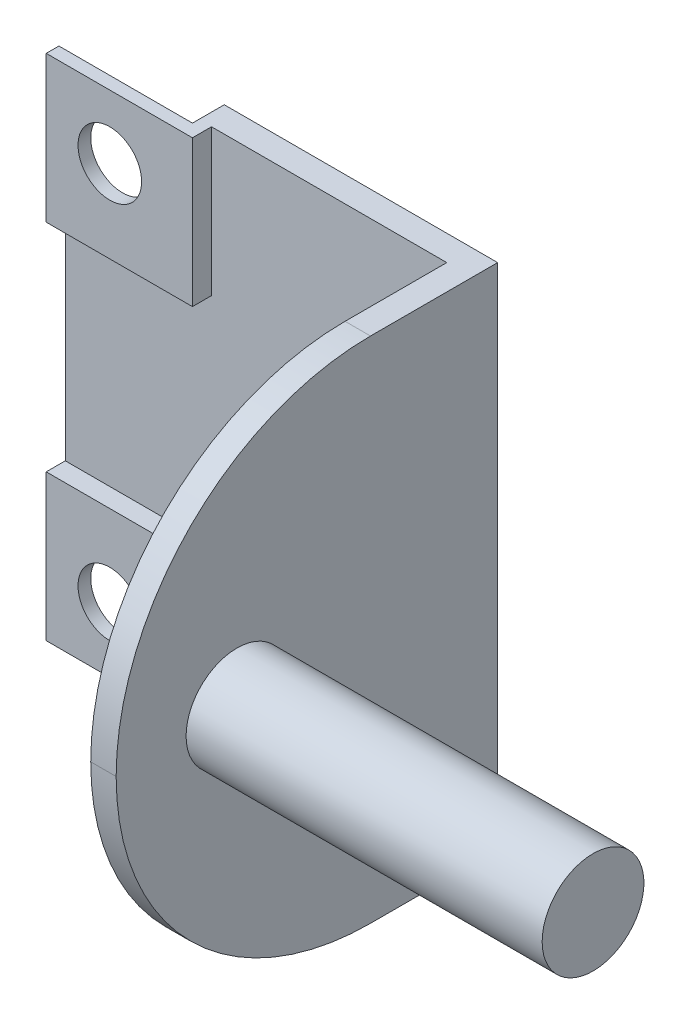
from build123d import *

# Parameters (mm, degrees)
ESQUISSE1_W             = 32
ESQUISSE1_H             = 40
BOSS_EXTRU_1_DEPTH      = 2
ESQUISSE2_W             = 2
ESQUISSE2_H             = 40
BOSS_EXTRU_2_DEPTH      = 28
CONG_1_R                = 20
ESQUISSE3_R             = 4
ENL_V_MAT_EXTRU_1_DEPTH = 30
ESQUISSE4_W             = 10.5
ESQUISSE4_H             = 10.5
ENL_V_MAT_EXTRU_2_DEPTH = 30
ESQUISSE5_W             = 1
ESQUISSE5_H             = 1
ESQUISSE5_W_2           = 10.5
ESQUISSE5_H_2           = 10.5
BOSS_EXTRU_5_DEPTH      = 1.5
ESQUISSE6_W             = 1
ESQUISSE6_H             = 10.5
BOSS_EXTRU_6_DEPTH      = 10.5
ESQUISSE7_R             = 2.5
ENL_V_MAT_EXTRU_3_DEPTH = 10.5
BOSS_EXTRU_7_START      = -30
ESQUISSE8_R             = 4
BOSS_EXTRU_7_DEPTH      = 30


with BuildPart() as part:
    # Esquisse1 → Boss.-Extru.1 (new body)
    with BuildSketch(Plane.XY):
        with Locations((-16, 20)):
            Rectangle(ESQUISSE1_W, ESQUISSE1_H)
    extrude(amount=BOSS_EXTRU_1_DEPTH)

    # Esquisse2 → Boss.-Extru.2 (add)
    with BuildSketch(Plane.XY.offset(2)):
        with Locations((-1, 20)):
            Rectangle(ESQUISSE2_W, ESQUISSE2_H)
    extrude(amount=BOSS_EXTRU_2_DEPTH)

    # Congé1
    cong_1_edges = [part.edges().sort_by_distance(p)[0] for p in [
        (-1, 40, 30),
        (-1, 0, 30),
    ]]
    fillet(cong_1_edges, radius=CONG_1_R - 0.0001)  # a hair under: the kernel refuses the full size

    # Esquisse3 → Enlèv. mat.-Extru.1 (cut)
    with BuildSketch(Plane(origin=(0, 0, 0), x_dir=(0, 0, -1), z_dir=(1, 0, 0))):
        with Locations(Location((-20.5, 20, 0), (0, 0, 90))):
            Circle(ESQUISSE3_R)
    extrude(amount=-ENL_V_MAT_EXTRU_1_DEPTH, mode=Mode.SUBTRACT)

    # Esquisse4 → Enlèv. mat.-Extru.2 (cut)
    with BuildSketch(Plane.XY.offset(2)):
        with Locations((-26.75, 34.75)):
            Rectangle(ESQUISSE4_W, ESQUISSE4_H)
        with Locations((-26.75, 5.25)):
            Rectangle(ESQUISSE4_W, ESQUISSE4_H)
    extrude(amount=-ENL_V_MAT_EXTRU_2_DEPTH, mode=Mode.SUBTRACT)

    # Esquisse5 → Boss.-Extru.5 (add)
    with BuildSketch(Plane.XY.offset(2)):
        with Locations((-21, 29)):
            Rectangle(ESQUISSE5_W, ESQUISSE5_H)
        with Locations((-26.75, 29)):
            Rectangle(ESQUISSE5_W_2, ESQUISSE5_H)
        with Locations((-21, 34.75)):
            Rectangle(ESQUISSE5_W, ESQUISSE5_H_2)
        with Locations((-21, 11)):
            Rectangle(ESQUISSE5_W, ESQUISSE5_H)
        with Locations((-21, 5.25)):
            Rectangle(ESQUISSE5_W, ESQUISSE5_H_2)
        with Locations((-26.75, 11)):
            Rectangle(ESQUISSE5_W_2, ESQUISSE5_H)
    extrude(amount=BOSS_EXTRU_5_DEPTH)

    # Esquisse6 → Boss.-Extru.6 (add)
    with BuildSketch(Plane.ZY.offset(21.5)):
        with Locations((3, 34.75)):
            Rectangle(ESQUISSE6_W, ESQUISSE6_H)
        with Locations((3, 5.25)):
            Rectangle(ESQUISSE6_W, ESQUISSE6_H)
    extrude(amount=BOSS_EXTRU_6_DEPTH)

    # Esquisse7 → Enlèv. mat.-Extru.3 (cut)
    with BuildSketch(Plane.XY.offset(3.5)):
        with Locations((-27, 35)):
            Circle(ESQUISSE7_R)
        with Locations((-27, 5)):
            Circle(ESQUISSE7_R)
    extrude(amount=-ENL_V_MAT_EXTRU_3_DEPTH, mode=Mode.SUBTRACT)

    # Esquisse8 → Boss.-Extru.7 (add)
    with BuildSketch(Plane.ZY.offset(2).offset(BOSS_EXTRU_7_START)):
        with Locations((20.5, 20)):
            Circle(ESQUISSE8_R)
    extrude(amount=BOSS_EXTRU_7_DEPTH)


solid = part.part
